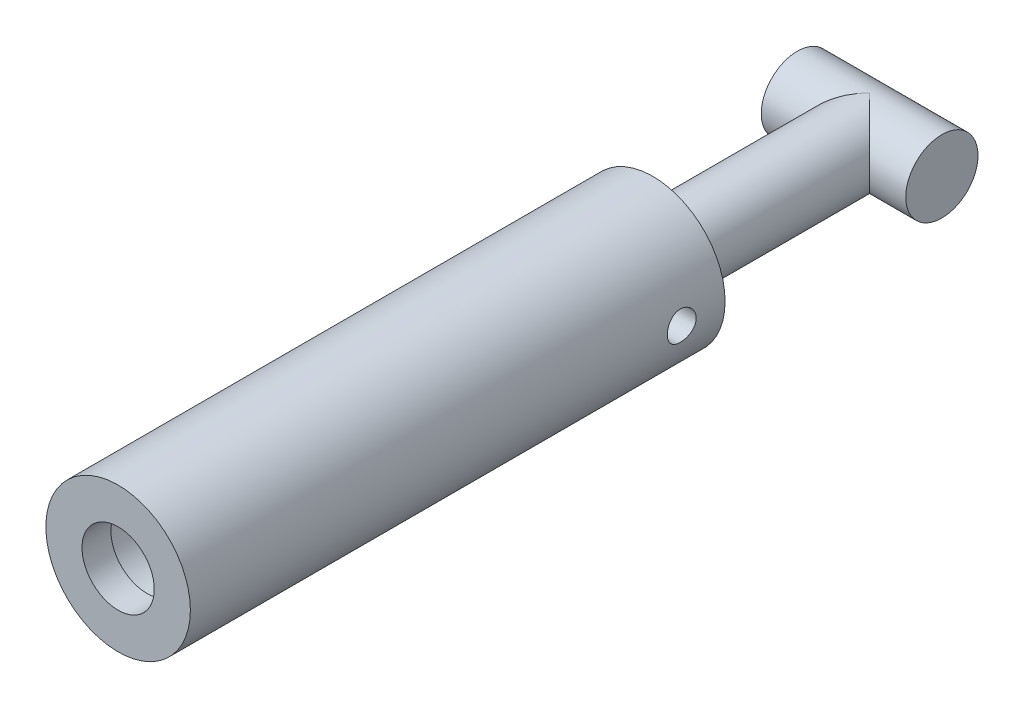
from build123d import *

# Parameters (mm, degrees)
SKETCH1_R                = 5
BOSS_EXTRUDE1_DEPTH      = 37
SKETCH2_R                = 2.5
CUT_EXTRUDE1_DEPTH       = 2
SKETCH3_R                = 3
CUT_EXTRUDE2_DEPTH       = 33
CUT_EXTRUDE3_START       = -5.000000101
CUT_EXTRUDE3_OUTLINE_R   = 1
CUT_EXTRUDE3_DEPTH       = 10.000000201
SKETCH4_R                = 2.5
BOSS_EXTRUDE2_DEPTH      = 15
BOSS_EXTRUDE3_DEPTH      = 5
BOSS_EXTRUDE3_DEPTH_BACK = 5
SKETCH5_R                = 2.5


# Read off the part's stored shape, not the designer's step: Cut-Extrude3
with BuildPart() as part:
    # Sketch1 → Boss-Extrude1 (new body)
    with BuildSketch(Plane.XY):
        Circle(SKETCH1_R)
    extrude(amount=BOSS_EXTRUDE1_DEPTH)

    # Sketch2 → Cut-Extrude1 (cut)
    with BuildSketch(Plane.XY.offset(37)):
        Circle(SKETCH2_R)
    extrude(amount=-CUT_EXTRUDE1_DEPTH, mode=Mode.SUBTRACT)

    # Sketch3 → Cut-Extrude2 (cut)
    with BuildSketch(Plane.XY.offset(35)):
        Circle(SKETCH3_R)
    extrude(amount=-CUT_EXTRUDE2_DEPTH, mode=Mode.SUBTRACT)

    # Cut-Extrude3 outline → Cut-Extrude3 (cut)
    with BuildSketch(Plane.YZ.offset(CUT_EXTRUDE3_START)):
        with Locations((0, 3)):
            Circle(CUT_EXTRUDE3_OUTLINE_R)
    extrude(amount=CUT_EXTRUDE3_DEPTH, mode=Mode.SUBTRACT)

    # Sketch4 → Boss-Extrude2 (add)
    with BuildSketch(Plane(origin=(0, 0, 0), x_dir=(-1, 0, 0), z_dir=(0, 0, -1))):
        with Locations(Location((0, 0, 0), (0, 0, 180))):
            Circle(SKETCH4_R)
    extrude(amount=BOSS_EXTRUDE2_DEPTH)

    # Sketch5 → Boss-Extrude3 (add, two sides: drawn at the far end of the back side and taken through both)
    with BuildSketch(Plane(origin=(0, 0, 0), x_dir=(0, 0, -1), z_dir=(1, 0, 0)).offset(-BOSS_EXTRUDE3_DEPTH_BACK)):
        with Locations((15, 0)):
            Circle(SKETCH5_R)
    extrude(amount=BOSS_EXTRUDE3_DEPTH + BOSS_EXTRUDE3_DEPTH_BACK)


solid = part.part
